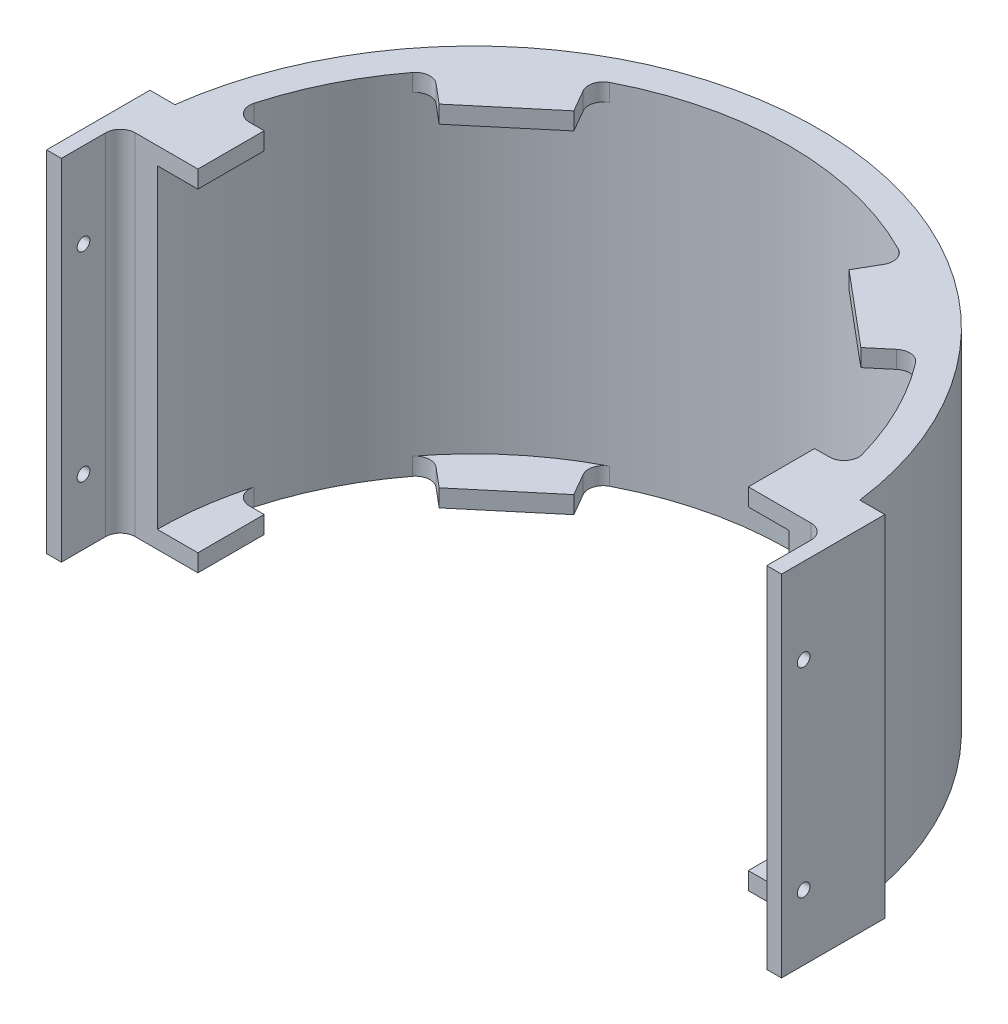
from build123d import *

# Parameters (mm, degrees)
BOSS_EXTRUDE1_DEPTH    = 118.5
BOSS_EXTRUDE2_DEPTH    = 5.9
FILLET1_R              = 5
CUT_EXTRUDE1_START     = -5
CUT_EXTRUDE1_OUTLINE_R = 2.15
CUT_EXTRUDE1_DEPTH     = 5


# Read off the part's stored shape, not the designer's step: Cut-Extrude1
with BuildPart() as part:
    # Sketch1 → Boss-Extrude1 (new body)
    with BuildSketch(Plane(origin=(0, 0, 0), x_dir=(1, 0, 0), z_dir=(0, 1, 0))):
        with BuildLine():
            Line((-116.034477635, 15), (-124.5, 15))
            Line((-124.5, 15), (-124.5, -20))
            Line((-124.5, -20), (-119.5, -20))
            Line((-119.5, -20), (-119.5, 0))
            Line((-119.5, 0), (-107, 0))
            ThreePointArc((-107, 0), (0, 107), (107, 0))
            Line((107, 0), (119.5, 0))
            Line((119.5, 0), (119.5, -20))
            Line((119.5, -20), (124.5, -20))
            Line((124.5, -20), (124.5, 15))
            Line((124.5, 15), (116.034477635, 15))
            ThreePointArc((116.034477635, 15), (0, 117), (-116.034477635, 15))
        make_face()
    extrude(amount=BOSS_EXTRUDE1_DEPTH)

    # Sketch2 → Boss-Extrude2 (add)
    with BuildSketch(Plane(origin=(0, 118.5, 0), x_dir=(1, 0, 0), z_dir=(0, 1, 0))):
        Polygon((-113.25, 0), (-93.25, 0), (-93.25, 22.466274611), (-110.99922975, 22.466274611), align=None)
        Polygon((-86.754533183, 72.795696797), (-71.433644321, 59.939944603), (-46.625, 80.756868903), (-56.625, 98.077376979), align=None)
        Polygon((110.99922975, 22.466274611), (113.25, 0), (93.25, 0), (93.25, 22.466274611), align=None)
        Polygon((46.625, 80.756868903), (56.625, 98.077376979), (86.754533183, 72.795696797), (71.433644321, 59.939944603), align=None)
    boss_extrude2 = extrude(amount=-BOSS_EXTRUDE2_DEPTH)

    # Mirror1: Boss-Extrude2 across plane
    add(boss_extrude2.mirror(Plane.ZX.offset(59.25)))

    # Fillet1
    fillet1_edges = [part.edges().sort_by_distance(p)[0] for p in [
        (53.5, 115.55, -92.664718205),
        (81.966755414, 115.55, -68.778274236),
        (-104.614848397, 2.95, -22.466274611),
        (104.614848397, 2.95, -22.466274611),
        (-81.966755414, 2.95, -68.778274236),
        (-53.5, 2.95, -92.664718205),
        (81.966755414, 2.95, -68.778274236),
        (53.5, 2.95, -92.664718205),
        (119.5, 59.25, 0),
        (-119.5, 59.25, 0),
        (-104.614848397, 115.55, -22.466274611),
        (104.614848397, 115.55, -22.466274611),
        (-53.5, 115.55, -92.664718205),
        (-81.966755414, 115.55, -68.778274236),
    ]]
    fillet(fillet1_edges, radius=FILLET1_R)

    # Cut-Extrude1 outline → Cut-Extrude1 (cut)
    with BuildSketch(Plane.ZY.offset(-119.5).offset(CUT_EXTRUDE1_START)):
        with Locations((12.5, 22.085284338)):
            Circle(CUT_EXTRUDE1_OUTLINE_R)
        with Locations((12.5, 89.629742653)):
            Circle(CUT_EXTRUDE1_OUTLINE_R)
    cut_extrude1 = extrude(amount=CUT_EXTRUDE1_DEPTH, mode=Mode.SUBTRACT)

    # Mirror2: Cut-Extrude1 across plane
    add(cut_extrude1.mirror(Plane(origin=(0, 0, 0), x_dir=(0, 0, 1), z_dir=(1, 0, 0))), mode=Mode.SUBTRACT)


solid = part.part
